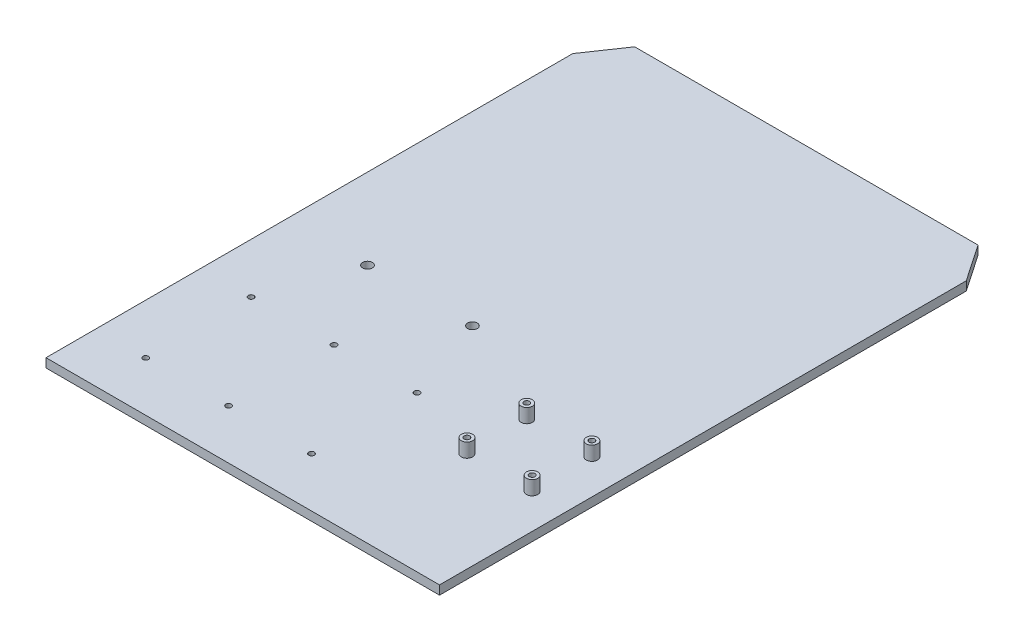
from build123d import *

# Parameters (mm, degrees)
SKETCH2_R           = 2
SKETCH2_R_2         = 3.455
BOSS_EXTRUDE1_DEPTH = 6.35
SKETCH3_R           = 4
SKETCH3_R_2         = 2
BOSS_EXTRUDE2_DEPTH = 10


with BuildPart() as part:
    # Sketch2 → Boss-Extrude1 (new body)
    with BuildSketch(Plane(origin=(0, 0, 0), x_dir=(1, 0, 0), z_dir=(0, 1, 0))):
        Polygon((0, 0), (280, 0), (280, 374.8), (262.142723834, 401.006270851), (140, 401.01), (17.857276166, 401.006270851), (0, 374.8), align=None)
        with Locations((35.5904475, 35.36504574)):
            Circle(SKETCH2_R, mode=Mode.SUBTRACT)
        with Locations((35.5904475, 110.36504574)):
            Circle(SKETCH2_R, mode=Mode.SUBTRACT)
        with Locations((94.5904475, 35.36504574)):
            Circle(SKETCH2_R, mode=Mode.SUBTRACT)
        with Locations((94.5904475, 110.36504574)):
            Circle(SKETCH2_R, mode=Mode.SUBTRACT)
        with Locations((153.5904475, 35.36504574)):
            Circle(SKETCH2_R, mode=Mode.SUBTRACT)
        with Locations((153.5904475, 110.36504574)):
            Circle(SKETCH2_R, mode=Mode.SUBTRACT)
        with Locations((57.382352913, 171.377840784)):
            Circle(SKETCH2_R_2, mode=Mode.SUBTRACT)
        with Locations((132.032352913, 171.377840784)):
            Circle(SKETCH2_R_2, mode=Mode.SUBTRACT)
    extrude(amount=BOSS_EXTRUDE1_DEPTH)

    # Sketch3 → Boss-Extrude2 (add)
    # profile 1 of 4: a face of its own
    with BuildSketch(Plane(origin=(0, 6.35, 0), x_dir=(1, 0, 0), z_dir=(0, 1, 0))):
        with Locations((208.92801279, 90.612310895)):
            Circle(SKETCH3_R)
        with Locations((208.92801279, 90.612310895)):
            Circle(SKETCH3_R_2, mode=Mode.SUBTRACT)
    # profile 2 of 4: a face of its own
    with BuildSketch(Plane(origin=(0, 6.35, 0), x_dir=(1, 0, 0), z_dir=(0, 1, 0))):
        with Locations((208.92801279, 133.157310895)):
            Circle(SKETCH3_R)
        with Locations((208.92801279, 133.157310895)):
            Circle(SKETCH3_R_2, mode=Mode.SUBTRACT)
    # profile 3 of 4: a face of its own
    with BuildSketch(Plane(origin=(0, 6.35, 0), x_dir=(1, 0, 0), z_dir=(0, 1, 0))):
        with Locations((255.28301279, 133.157310895)):
            Circle(SKETCH3_R)
        with Locations((255.28301279, 133.157310895)):
            Circle(SKETCH3_R_2, mode=Mode.SUBTRACT)
    # profile 4 of 4: a face of its own
    with BuildSketch(Plane(origin=(0, 6.35, 0), x_dir=(1, 0, 0), z_dir=(0, 1, 0))):
        with Locations((255.28301279, 90.612310895)):
            Circle(SKETCH3_R)
        with Locations((255.28301279, 90.612310895)):
            Circle(SKETCH3_R_2, mode=Mode.SUBTRACT)
    extrude(amount=BOSS_EXTRUDE2_DEPTH)


solid = part.part
